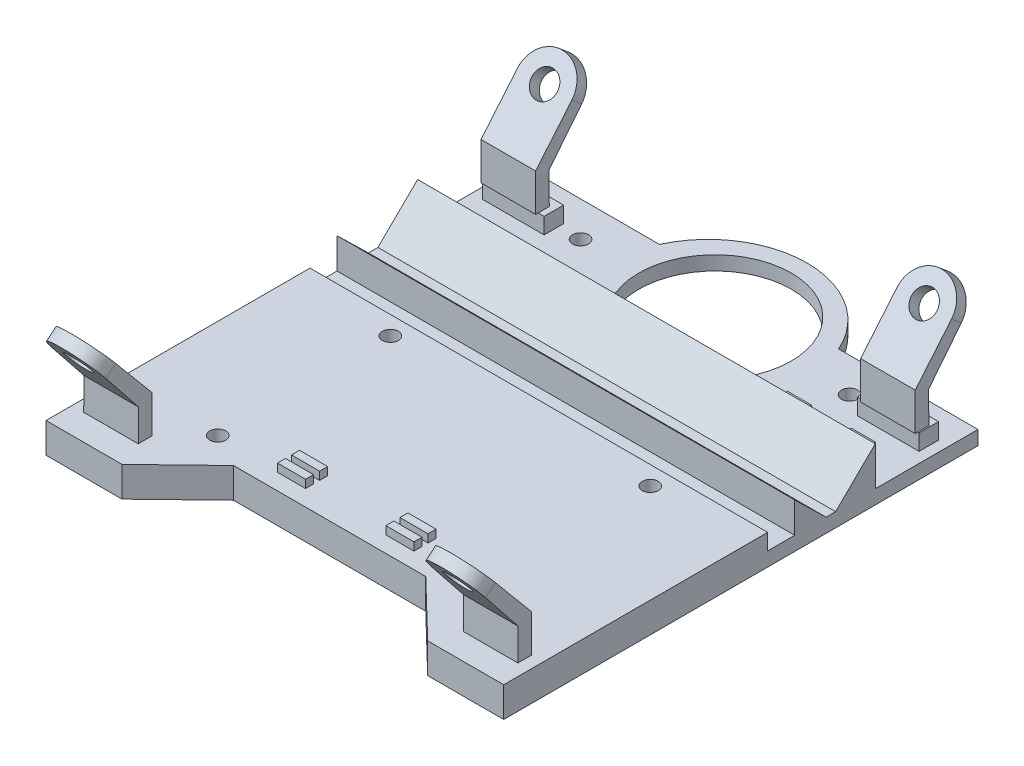
from build123d import *

# Parameters (mm, degrees)
SKIZZE1_W                        = 57
SKIZZE1_H                        = 60
AUFSATZ_LINEAR_AUSTRAGEN1_DEPTH  = 1.75
SKIZZE3_R                        = 9.495370676
SCHNITT_LINEAR_AUSTRAGEN1_DEPTH  = 2
SKIZZE4_W                        = 57
SKIZZE4_H                        = 26.054547174
AUFSATZ_LINEAR_AUSTRAGEN2_DEPTH  = 2
SKIZZE5_R                        = 1
SCHNITT_LINEAR_AUSTRAGEN2_DEPTH  = 4
AUFSATZ_LINEAR_AUSTRAGEN3_DEPTH  = 57
SKIZZE10_R                       = 1
SCHNITT_LINEAR_AUSTRAGEN3_DEPTH  = 2
AUFSATZ_LINEAR_AUSTRAGEN4_DEPTH  = 57
SKIZZE13_W                       = 3
SKIZZE13_H                       = 1
AUFSATZ_LINEAR_AUSTRAGEN6_DEPTH  = 1
SKIZZE16_W                       = 3.5
SKIZZE16_H                       = 1
AUFSATZ_LINEAR_AUSTRAGEN9_DEPTH  = 1
AUFSATZ_LINEAR_AUSTRAGEN11_DEPTH = 3.75
SKIZZE25_W                       = 6.8
SKIZZE25_H                       = 4.678014598
AUFSATZ_LINEAR_AUSTRAGEN12_DEPTH = 13
SKIZZE26_W                       = 6.272143652
SKIZZE26_H                       = 7.131924913
AUFSATZ_LINEAR_AUSTRAGEN13_DEPTH = 6.8
SCHNITT_LINEAR_AUSTRAGEN5_DEPTH  = 6.8
SCHNITT_LINEAR_AUSTRAGEN6_DEPTH  = 6.8
SCHNITT_LINEAR_AUSTRAGEN8_DEPTH  = 3.8
SKIZZE30_R                       = 1.6
SCHNITT_LINEAR_AUSTRAGEN9_DEPTH  = 3.8
SKIZZE31_W                       = 7.69751232
SKIZZE31_H                       = 2.429513609
AUFSATZ_LINEAR_AUSTRAGEN15_DEPTH = 2
SPIEGELN9_COPY_1_SKETCH_W        = 6.8
SPIEGELN9_COPY_1_SKETCH_H        = 4.678014598
SPIEGELN9_COPY_1_DEPTH           = 13
SPIEGELN9_COPY_2_SKETCH_W        = 6.272143652
SPIEGELN9_COPY_2_SKETCH_H        = 7.131924913
SPIEGELN9_COPY_2_DEPTH           = 6.8
SPIEGELN9_COPY_3_DEPTH           = 6.8
SPIEGELN9_COPY_4_DEPTH           = 6.8
SPIEGELN9_COPY_5_DEPTH           = 3.8
SPIEGELN9_COPY_6_SKETCH_R        = 1.6
SPIEGELN9_COPY_6_DEPTH           = 3.8
SPIEGELN9_COPY_7_SKETCH_W        = 6.8
SPIEGELN9_COPY_7_SKETCH_H        = 4.678014598
SPIEGELN9_COPY_7_DEPTH           = 13
SPIEGELN9_COPY_8_SKETCH_W        = 6.272143652
SPIEGELN9_COPY_8_SKETCH_H        = 7.131924913
SPIEGELN9_COPY_8_DEPTH           = 6.8
SPIEGELN9_COPY_9_DEPTH           = 6.8
SPIEGELN9_COPY_10_DEPTH          = 6.8
SPIEGELN9_COPY_11_DEPTH          = 3.8
SPIEGELN9_COPY_12_SKETCH_R       = 1.6
SPIEGELN9_COPY_12_DEPTH          = 3.8
SCHNITT_LINEAR_AUSTRAGEN10_DEPTH = 10
SCHNITT_LINEAR_AUSTRAGEN11_DEPTH = 10


with BuildPart() as part:
    # Skizze1 → Aufsatz-Linear austragen1 (new body)
    with BuildSketch(Plane(origin=(0, 0, 0), x_dir=(1, 0, 0), z_dir=(0, 1, 0))):
        with Locations((28.5, 30)):
            Rectangle(SKIZZE1_W, SKIZZE1_H)
    extrude(amount=-AUFSATZ_LINEAR_AUSTRAGEN1_DEPTH)

    # Skizze3 → Schnitt-Linear austragen1 (cut)
    with BuildSketch(Plane(origin=(0, 0, 0), x_dir=(1, 0, 0), z_dir=(0, 1, 0))):
        with Locations((28.5, 48)):
            Circle(SKIZZE3_R)
    extrude(amount=-SCHNITT_LINEAR_AUSTRAGEN1_DEPTH, mode=Mode.SUBTRACT)

    # Skizze4 → Aufsatz-Linear austragen2 (add)
    with BuildSketch(Plane(origin=(0, 0, 0), x_dir=(1, 0, 0), z_dir=(0, 1, 0))):
        with Locations((28.5, 13.027273587)):
            Rectangle(SKIZZE4_W, SKIZZE4_H)
    extrude(amount=AUFSATZ_LINEAR_AUSTRAGEN2_DEPTH)

    # Skizze5 → Schnitt-Linear austragen2 (cut)
    with BuildSketch(Plane(origin=(0, 2, 0), x_dir=(1, 0, 0), z_dir=(0, 1, 0))):
        with Locations((12.315263515, 23.744868689)):
            Circle(SKIZZE5_R)
        with Locations((12.315263515, 2.244868689)):
            Circle(SKIZZE5_R)
    schnitt_linear_austragen2 = extrude(amount=-SCHNITT_LINEAR_AUSTRAGEN2_DEPTH, mode=Mode.SUBTRACT)

    # Spiegeln1: Schnitt-Linear austragen2 across plane
    add(schnitt_linear_austragen2.mirror(Plane.ZY.offset(-28.5)), mode=Mode.SUBTRACT)

    # Skizze8 → Aufsatz-Linear austragen3 (add)
    with BuildSketch(Plane.ZY):
        Polygon((-29.419890543, 3.815337259), (-33.325270164, 0), (-29.419890543, 0), align=None)
    extrude(amount=-AUFSATZ_LINEAR_AUSTRAGEN3_DEPTH)

    # Skizze10 → Schnitt-Linear austragen3 (cut)
    with BuildSketch(Plane(origin=(0, 0, 0), x_dir=(1, 0, 0), z_dir=(0, 1, 0))):
        with Locations((45.25, 48)):
            Circle(SKIZZE10_R)
        with Locations((11.75, 48)):
            Circle(SKIZZE10_R)
    extrude(amount=-SCHNITT_LINEAR_AUSTRAGEN3_DEPTH, mode=Mode.SUBTRACT)

    # Skizze11 → Aufsatz-Linear austragen4 (add)
    with BuildSketch(Plane.ZY):
        Polygon((-39.458282478, 4.85029471), (-39.458282478, 0), (-34.51169532, 0), align=None)
    extrude(amount=-AUFSATZ_LINEAR_AUSTRAGEN4_DEPTH)

    # Skizze13 → Aufsatz-Linear austragen6 (add)
    with BuildSketch(Plane(origin=(0, 0, 0), x_dir=(1, 0, 0), z_dir=(0, 1, 0))):
        with Locations((51.5, 43)):
            Rectangle(SKIZZE13_W, SKIZZE13_H)
        with Locations((43.5, 43)):
            Rectangle(SKIZZE13_W, SKIZZE13_H)
        with Locations((51.5, 41.25)):
            Rectangle(SKIZZE13_W, SKIZZE13_H)
        with Locations((43.5, 41.25)):
            Rectangle(SKIZZE13_W, SKIZZE13_H)
    extrude(amount=AUFSATZ_LINEAR_AUSTRAGEN6_DEPTH)

    # Skizze16 → Aufsatz-Linear austragen9 (add)
    with BuildSketch(Plane(origin=(0, 2, 0), x_dir=(1, 0, 0), z_dir=(0, 1, 0))):
        with Locations((21.75, 2.5)):
            Rectangle(SKIZZE16_W, SKIZZE16_H)
        with Locations((35.25, 2.5)):
            Rectangle(SKIZZE16_W, SKIZZE16_H)
        with Locations((21.75, 4.25)):
            Rectangle(SKIZZE16_W, SKIZZE16_H)
        with Locations((35.25, 4.25)):
            Rectangle(SKIZZE16_W, SKIZZE16_H)
    extrude(amount=AUFSATZ_LINEAR_AUSTRAGEN9_DEPTH)

    # Skizze24 → Aufsatz-Linear austragen11 (add)
    with BuildSketch(Plane(origin=(0, 2, 0), x_dir=(1, 0, 0), z_dir=(0, 1, 0))):
        Polygon((57, 0), (57, -15.963189927), (46.470395694, -5.79521838), (40.469065327, 0), align=None)
    aufsatz_linear_austragen11 = extrude(amount=-AUFSATZ_LINEAR_AUSTRAGEN11_DEPTH)

    # Spiegeln2: Aufsatz-Linear austragen11 across plane
    add(aufsatz_linear_austragen11.mirror(Plane.ZY.offset(-28.5)))

    # Skizze25 → Aufsatz-Linear austragen12 (add)
    with BuildSketch(Plane(origin=(0, 2, 0), x_dir=(1, 0, 0), z_dir=(0, 1, 0))):
        with Locations((52.135864274, -3.62433538)):
            Rectangle(SKIZZE25_W, SKIZZE25_H)
    aufsatz_linear_austragen12 = extrude(amount=AUFSATZ_LINEAR_AUSTRAGEN12_DEPTH)

    # Skizze26 → Aufsatz-Linear austragen13 (add)
    with BuildSketch(Plane(origin=(55.535864274, 0, 0), x_dir=(0, 0, -1), z_dir=(1, 0, 0))):
        with Locations((-9.099414505, 11.434037544)):
            Rectangle(SKIZZE26_W, SKIZZE26_H)
    aufsatz_linear_austragen13 = extrude(amount=-AUFSATZ_LINEAR_AUSTRAGEN13_DEPTH)

    # Skizze27 → Schnitt-Linear austragen5 (cut)
    with BuildSketch(Plane(origin=(55.535864274, 0, 0), x_dir=(0, 0, -1), z_dir=(1, 0, 0))):
        Polygon((-10.768511785, 15), (-3.552210741, 5.947030188), (-3.590728104, 2), (-6.081048451, 2), (-5.963342679, 7.868075087), (-12.235486331, 7.868075087), (-12.235486331, 15), align=None)
    schnitt_linear_austragen5 = extrude(amount=-SCHNITT_LINEAR_AUSTRAGEN5_DEPTH, mode=Mode.SUBTRACT)

    # Skizze28 → Schnitt-Linear austragen6 (cut)
    with BuildSketch(Plane(origin=(55.535864274, 0, 0), x_dir=(0, 0, -1), z_dir=(1, 0, 0))):
        Polygon((-9.855196272, 13.854230483), (-8.675818052, 14.794336156), (-1.891775147, 6.686320141), (-1.891775147, 2), (-1.241465065, 2), (-1.241465065, 15.430103774), (-11.112831421, 15.430103774), align=None)
    schnitt_linear_austragen6 = extrude(amount=-SCHNITT_LINEAR_AUSTRAGEN6_DEPTH, mode=Mode.SUBTRACT)

    # Skizze29 → Schnitt-Linear austragen8 (cut)
    with BuildSketch(Plane(origin=(0, 1.822324688, -2.177969385), x_dir=(-1, 0, 0), z_dir=(0, 0.6417106486161895, -0.7669468322201934))):
        with BuildLine():
            Line((-55.535864274, 13.383825147), (-55.535864274, 17.083825147))
            Line((-55.535864274, 17.083825147), (-48.735864274, 17.083825147))
            Line((-48.735864274, 17.083825147), (-48.735864274, 13.383825147))
            ThreePointArc((-48.735864274, 13.383825147), (-52.135864274, 16.783825147), (-55.535864274, 13.383825147))
        make_face()
    schnitt_linear_austragen8 = extrude(amount=-SCHNITT_LINEAR_AUSTRAGEN8_DEPTH, mode=Mode.SUBTRACT)

    # Skizze30 → Schnitt-Linear austragen9 (cut)
    with BuildSketch(Plane(origin=(0, 1.822324688, -2.177969385), x_dir=(-1, 0, 0), z_dir=(0, 0.6417106486161896, -0.7669468322201933))):
        with Locations((-52.135864274, 13.383825147)):
            Circle(SKIZZE30_R)
    schnitt_linear_austragen9 = extrude(amount=-SCHNITT_LINEAR_AUSTRAGEN9_DEPTH, mode=Mode.SUBTRACT)

    # Spiegeln6: Aufsatz-Linear austragen12, Aufsatz-Linear austragen13, Schnitt-Linear austragen5, Schnitt-Linear austragen6, Schnitt-Linear austragen8, Schnitt-Linear austragen9 across plane
    add(aufsatz_linear_austragen12.mirror(Plane.ZY.offset(-28.5)))
    add(aufsatz_linear_austragen13.mirror(Plane.ZY.offset(-28.5)))
    add(schnitt_linear_austragen5.mirror(Plane.ZY.offset(-28.5)), mode=Mode.SUBTRACT)
    add(schnitt_linear_austragen6.mirror(Plane.ZY.offset(-28.5)), mode=Mode.SUBTRACT)
    add(schnitt_linear_austragen8.mirror(Plane.ZY.offset(-28.5)), mode=Mode.SUBTRACT)
    add(schnitt_linear_austragen9.mirror(Plane.ZY.offset(-28.5)), mode=Mode.SUBTRACT)

    # Skizze31 → Aufsatz-Linear austragen15 (add)
    with BuildSketch(Plane(origin=(0, 0, 0), x_dir=(1, 0, 0), z_dir=(0, 1, 0))):
        with Locations((51.84875616, 47.423389314)):
            Rectangle(SKIZZE31_W, SKIZZE31_H)
    aufsatz_linear_austragen15 = extrude(amount=AUFSATZ_LINEAR_AUSTRAGEN15_DEPTH)

    # Spiegeln8: Aufsatz-Linear austragen12, Aufsatz-Linear austragen13, Schnitt-Linear austragen5, Schnitt-Linear austragen6, Schnitt-Linear austragen8, Schnitt-Linear austragen9 across plane
    add(aufsatz_linear_austragen12.mirror(Plane(origin=(0, 0, -22), x_dir=(1, 0, 0), z_dir=(0, 0, -1))))
    add(aufsatz_linear_austragen13.mirror(Plane(origin=(0, 0, -22), x_dir=(1, 0, 0), z_dir=(0, 0, -1))))
    add(schnitt_linear_austragen5.mirror(Plane(origin=(0, 0, -22), x_dir=(1, 0, 0), z_dir=(0, 0, -1))), mode=Mode.SUBTRACT)
    add(schnitt_linear_austragen6.mirror(Plane(origin=(0, 0, -22), x_dir=(1, 0, 0), z_dir=(0, 0, -1))), mode=Mode.SUBTRACT)
    add(schnitt_linear_austragen8.mirror(Plane(origin=(0, 0, -22), x_dir=(1, 0, 0), z_dir=(0, 0, -1))), mode=Mode.SUBTRACT)
    add(schnitt_linear_austragen9.mirror(Plane(origin=(0, 0, -22), x_dir=(1, 0, 0), z_dir=(0, 0, -1))), mode=Mode.SUBTRACT)

    # Spiegeln9: Aufsatz-Linear austragen15 across plane
    add(aufsatz_linear_austragen15.mirror(Plane.ZY.offset(-28.5)))

    # Spiegeln9 copy 1 sketch → Spiegeln9 copy 1 (add)
    with BuildSketch(Plane(origin=(57, 2, -44), x_dir=(-1, 0, 0), z_dir=(0, 1, 0))):
        with Locations((52.135864274, -3.62433538)):
            Rectangle(SPIEGELN9_COPY_1_SKETCH_W, SPIEGELN9_COPY_1_SKETCH_H)
    extrude(amount=SPIEGELN9_COPY_1_DEPTH)

    # Spiegeln9 copy 2 sketch → Spiegeln9 copy 2 (add)
    with BuildSketch(Plane(origin=(1.464135726, 0, -44), x_dir=(0, 0, 1), z_dir=(-1, 0, 0))):
        with Locations((-9.099414505, 11.434037544)):
            Rectangle(SPIEGELN9_COPY_2_SKETCH_W, SPIEGELN9_COPY_2_SKETCH_H)
    extrude(amount=-SPIEGELN9_COPY_2_DEPTH)

    # Spiegeln9 copy 3 sketch → Spiegeln9 copy 3 (cut)
    with BuildSketch(Plane(origin=(1.464135726, 0, -44), x_dir=(0, 0, 1), z_dir=(-1, 0, 0))):
        Polygon((-10.768511785, 15), (-3.552210741, 5.947030188), (-3.590728104, 2), (-6.081048451, 2), (-5.963342679, 7.868075087), (-12.235486331, 7.868075087), (-12.235486331, 15), align=None)
    extrude(amount=-SPIEGELN9_COPY_3_DEPTH, mode=Mode.SUBTRACT)

    # Spiegeln9 copy 4 sketch → Spiegeln9 copy 4 (cut)
    with BuildSketch(Plane(origin=(1.464135726, 0, -44), x_dir=(0, 0, 1), z_dir=(-1, 0, 0))):
        Polygon((-9.855196272, 13.854230483), (-8.675818052, 14.794336156), (-1.891775147, 6.686320141), (-1.891775147, 2), (-1.241465065, 2), (-1.241465065, 15.430103774), (-11.112831421, 15.430103774), align=None)
    extrude(amount=-SPIEGELN9_COPY_4_DEPTH, mode=Mode.SUBTRACT)

    # Spiegeln9 copy 5 sketch → Spiegeln9 copy 5 (cut)
    with BuildSketch(Plane(origin=(57, 1.822324688, -41.822030615), x_dir=(1, 0, 0), z_dir=(0, 0.6417106486161895, 0.7669468322201934))):
        with BuildLine():
            Line((-55.535864274, 13.383825147), (-55.535864274, 17.083825147))
            Line((-55.535864274, 17.083825147), (-48.735864274, 17.083825147))
            Line((-48.735864274, 17.083825147), (-48.735864274, 13.383825147))
            ThreePointArc((-48.735864274, 13.383825147), (-52.135864274, 16.783825147), (-55.535864274, 13.383825147))
        make_face()
    extrude(amount=-SPIEGELN9_COPY_5_DEPTH, mode=Mode.SUBTRACT)

    # Spiegeln9 copy 6 sketch → Spiegeln9 copy 6 (cut)
    with BuildSketch(Plane(origin=(57, 1.822324688, -41.822030615), x_dir=(1, 0, 0), z_dir=(0, 0.6417106486161896, 0.7669468322201933))):
        with Locations((-52.135864274, 13.383825147)):
            Circle(SPIEGELN9_COPY_6_SKETCH_R)
    extrude(amount=-SPIEGELN9_COPY_6_DEPTH, mode=Mode.SUBTRACT)

    # Spiegeln9 copy 7 sketch → Spiegeln9 copy 7 (add)
    with BuildSketch(Plane(origin=(57, 2, 0), x_dir=(-1, 0, 0), z_dir=(0, 1, 0))):
        with Locations((52.135864274, 3.62433538)):
            Rectangle(SPIEGELN9_COPY_7_SKETCH_W, SPIEGELN9_COPY_7_SKETCH_H)
    extrude(amount=SPIEGELN9_COPY_7_DEPTH)

    # Spiegeln9 copy 8 sketch → Spiegeln9 copy 8 (add)
    with BuildSketch(Plane(origin=(1.464135726, 0, 0), x_dir=(0, 0, -1), z_dir=(-1, 0, 0))):
        with Locations((-9.099414505, -11.434037544)):
            Rectangle(SPIEGELN9_COPY_8_SKETCH_W, SPIEGELN9_COPY_8_SKETCH_H)
    extrude(amount=-SPIEGELN9_COPY_8_DEPTH)

    # Spiegeln9 copy 9 sketch → Spiegeln9 copy 9 (cut)
    with BuildSketch(Plane(origin=(1.464135726, 0, 0), x_dir=(0, 0, -1), z_dir=(-1, 0, 0))):
        Polygon((-10.768511785, -15), (-3.552210741, -5.947030188), (-3.590728104, -2), (-6.081048451, -2), (-5.963342679, -7.868075087), (-12.235486331, -7.868075087), (-12.235486331, -15), align=None)
    extrude(amount=-SPIEGELN9_COPY_9_DEPTH, mode=Mode.SUBTRACT)

    # Spiegeln9 copy 10 sketch → Spiegeln9 copy 10 (cut)
    with BuildSketch(Plane(origin=(1.464135726, 0, 0), x_dir=(0, 0, -1), z_dir=(-1, 0, 0))):
        Polygon((-9.855196272, -13.854230483), (-8.675818052, -14.794336156), (-1.891775147, -6.686320141), (-1.891775147, -2), (-1.241465065, -2), (-1.241465065, -15.430103774), (-11.112831421, -15.430103774), align=None)
    extrude(amount=-SPIEGELN9_COPY_10_DEPTH, mode=Mode.SUBTRACT)

    # Spiegeln9 copy 11 sketch → Spiegeln9 copy 11 (cut)
    with BuildSketch(Plane(origin=(57, 1.822324688, -2.177969385), x_dir=(1, 0, 0), z_dir=(0, 0.6417106486161895, -0.7669468322201934))):
        with BuildLine():
            Line((-55.535864274, -13.383825147), (-55.535864274, -17.083825147))
            Line((-55.535864274, -17.083825147), (-48.735864274, -17.083825147))
            Line((-48.735864274, -17.083825147), (-48.735864274, -13.383825147))
            ThreePointArc((-48.735864274, -13.383825147), (-52.135864274, -16.783825147), (-55.535864274, -13.383825147))
        make_face()
    extrude(amount=-SPIEGELN9_COPY_11_DEPTH, mode=Mode.SUBTRACT)

    # Spiegeln9 copy 12 sketch → Spiegeln9 copy 12 (cut)
    with BuildSketch(Plane(origin=(57, 1.822324688, -2.177969385), x_dir=(1, 0, 0), z_dir=(0, 0.6417106486161896, -0.7669468322201933))):
        with Locations((-52.135864274, -13.383825147)):
            Circle(SPIEGELN9_COPY_12_SKETCH_R)
    extrude(amount=-SPIEGELN9_COPY_12_DEPTH, mode=Mode.SUBTRACT)

    # Skizze36 → Schnitt-Linear austragen10 (cut)
    with BuildSketch(Plane(origin=(0, 0, 0), x_dir=(1, 0, 0), z_dir=(0, 1, 0))):
        with BuildLine():
            Line((0, 52.369033875), (17.208372804, 52.369033875))
            ThreePointArc((17.208372804, 52.369033875), (28.464546382, 59.557465407), (39.640881486, 52.2455214))
            Line((39.640881486, 52.2455214), (57, 52.2455214))
            Line((57, 52.2455214), (57, 60))
            Line((57, 60), (0, 60))
            Line((0, 60), (0, 52.369033875))
        make_face()
    extrude(amount=-SCHNITT_LINEAR_AUSTRAGEN10_DEPTH, mode=Mode.SUBTRACT)

    # Skizze37 → Schnitt-Linear austragen11 (cut)
    with BuildSketch(Plane(origin=(0, 2, 0), x_dir=(1, 0, 0), z_dir=(0, 1, 0))):
        Polygon((0, -6.821439936), (9.576067719, -6.821439936), (0, -15.963189927), align=None)
    schnitt_linear_austragen11 = extrude(amount=-SCHNITT_LINEAR_AUSTRAGEN11_DEPTH, mode=Mode.SUBTRACT)

    # Spiegeln10: Schnitt-Linear austragen11 across plane
    add(schnitt_linear_austragen11.mirror(Plane.ZY.offset(-28.5)), mode=Mode.SUBTRACT)


solid = part.part
